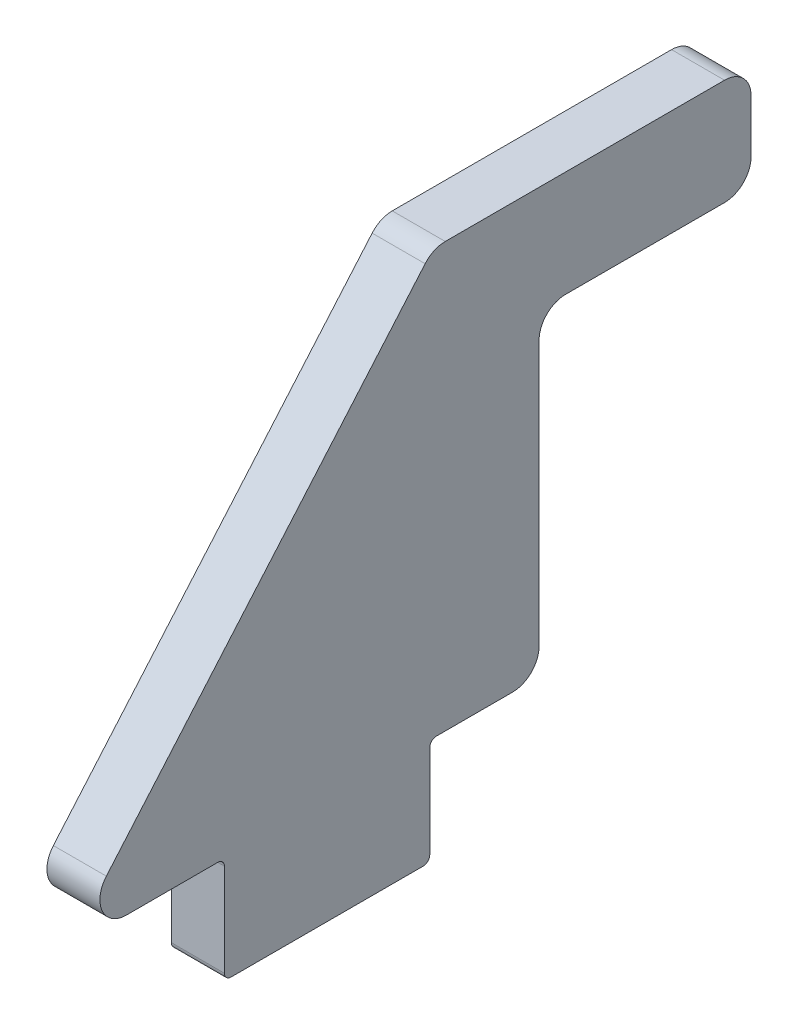
from build123d import *

# Parameters (mm, degrees)
BASE_FLANGE1_DEPTH = 6.35
FILLET1_R          = 3.175
FILLET2_R          = 0.79375


# Sheet-metal steps are written as plain solids
with BuildPart() as part:
    # Sketch1 → Base-Flange1 (new body)
    with BuildSketch(Plane(origin=(0, 0, 0), x_dir=(0, 0, -1), z_dir=(1, 0, 0))):
        Polygon((-56.35625, 0), (-12.7, 50.8), (25.4, 50.8), (25.4, 38.1), (0, 38.1), (0, 0), (-13.096875, 0), (-13.096875, -12.7), (-37.703125, -12.7), (-37.703125, 0), align=None)
    extrude(amount=-BASE_FLANGE1_DEPTH)

    # Fillet1
    fillet1_edges = [part.edges().sort_by_distance(p)[0] for p in [
        (-3.175, 0, 56.35625),
        (-3.175, 50.8, 12.7),
        (-3.175, 50.8, -25.4),
        (-3.175, 38.1, -25.4),
        (-3.175, 38.1, 0),
        (-3.175, 0, 0),
    ]]
    fillet(fillet1_edges, radius=FILLET1_R)

    # Fillet2
    fillet2_edges = [part.edges().sort_by_distance(p)[0] for p in [
        (-3.175, 0, 13.096875),
        (-3.175, -12.7, 13.096875),
        (-3.175, -12.7, 37.703125),
        (-3.175, 0, 37.703125),
    ]]
    fillet(fillet2_edges, radius=FILLET2_R)


solid = part.part
